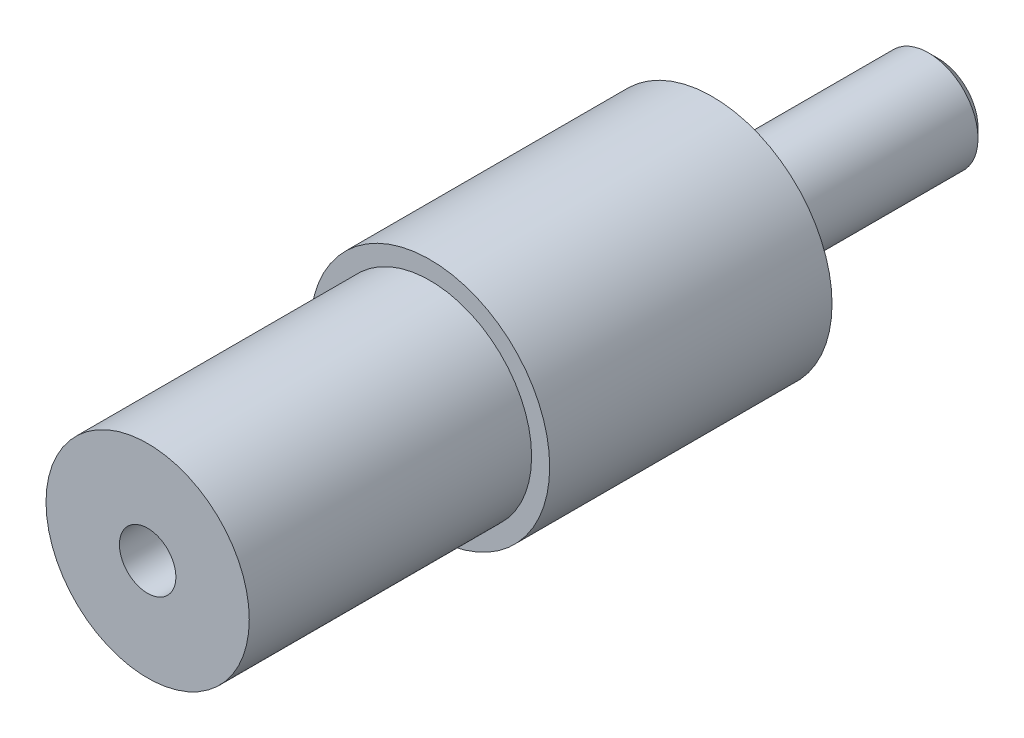
from build123d import *

# Parameters (mm, degrees)
SKETCH1_R           = 13.462
BOSS_EXTRUDE1_DEPTH = 31.75
SKETCH2_R           = 11.43
BOSS_EXTRUDE2_DEPTH = 31.75
SKETCH3_R           = 3.175
CUT_EXTRUDE1_DEPTH  = 25.4


# Read off the part's stored shape, not the designer's step: 7/16-14 Machine Threads Stud1
with BuildPart() as part:
    # Sketch1 → Boss-Extrude1 (new body)
    with BuildSketch(Plane.XY):
        Circle(SKETCH1_R)
    extrude(amount=BOSS_EXTRUDE1_DEPTH)

    # Sketch2 → Boss-Extrude2 (add)
    with BuildSketch(Plane.XY.offset(31.75)):
        Circle(SKETCH2_R)
    extrude(amount=BOSS_EXTRUDE2_DEPTH)

    # Sketch3 → Cut-Extrude1 (cut)
    with BuildSketch(Plane.XY.offset(63.5)):
        Circle(SKETCH3_R)
    extrude(amount=-CUT_EXTRUDE1_DEPTH, mode=Mode.SUBTRACT)

    # 7/16-14 Machine Threads Stud1 outline → 7/16-14 Machine Threads Stud1 (revolve)
    with BuildSketch(Plane.XZ):
        Polygon((0, 0), (0, -25.4), (4.47675, -25.4), (5.55625, -24.3205), (5.55625, 0), align=None)
    revolve(axis=Axis((0, 0, 0), (0, 0, 1)))


solid = part.part
